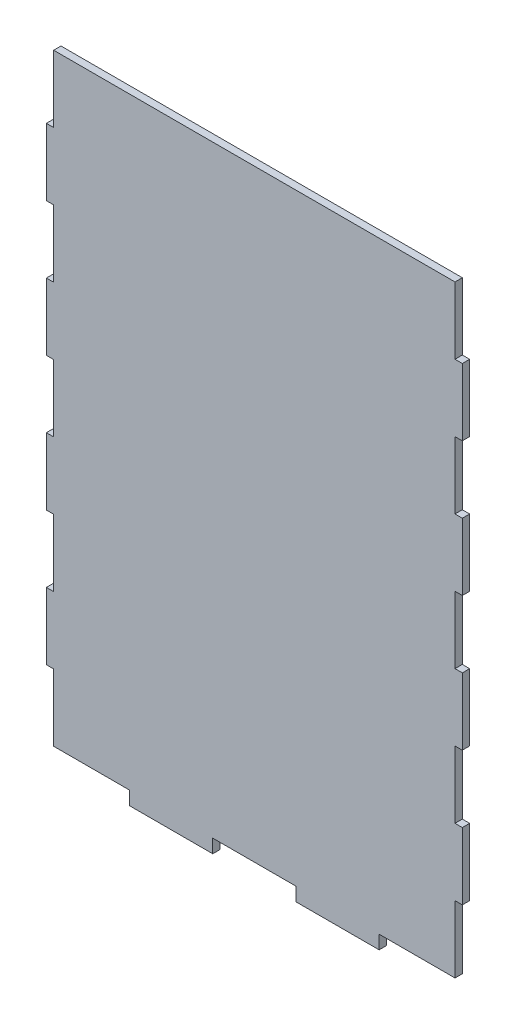
from build123d import *

# Parameters (mm, degrees)
BOSS_EXTRUDE2_DEPTH = 2.7


with BuildPart() as part:
    # Sketch1 → Boss-Extrude2 (new body)
    with BuildSketch(Plane.XY):
        Polygon((46.02, -108.65), (74, -108.65), (74, -83.95), (76.7, -83.95), (76.7, -59.25), (74, -59.25), (74, -34.55), (76.7, -34.55), (76.7, -9.85), (74, -9.85), (74, 14.85), (76.7, 14.85), (76.7, 39.55), (74, 39.55), (74, 64.25), (76.7, 64.25), (76.7, 88.95), (74, 88.95), (74, 113.65), (-74, 113.65), (-74, 88.95), (-76.7, 88.95), (-76.7, 64.25), (-74, 64.25), (-74, 39.55), (-76.7, 39.55), (-76.7, 14.85), (-74, 14.85), (-74, -9.85), (-76.7, -9.85), (-76.7, -34.55), (-74, -34.55), (-74, -59.25), (-76.7, -59.25), (-76.7, -61.75), (-76.7, -83.95), (-74, -83.95), (-74, -108.65), (-46.02, -108.65), (-46.02, -113.65), (-15.34, -113.65), (-15.34, -108.65), (15.34, -108.65), (15.34, -113.65), (46.02, -113.65), align=None)
    extrude(amount=BOSS_EXTRUDE2_DEPTH)


solid = part.part
